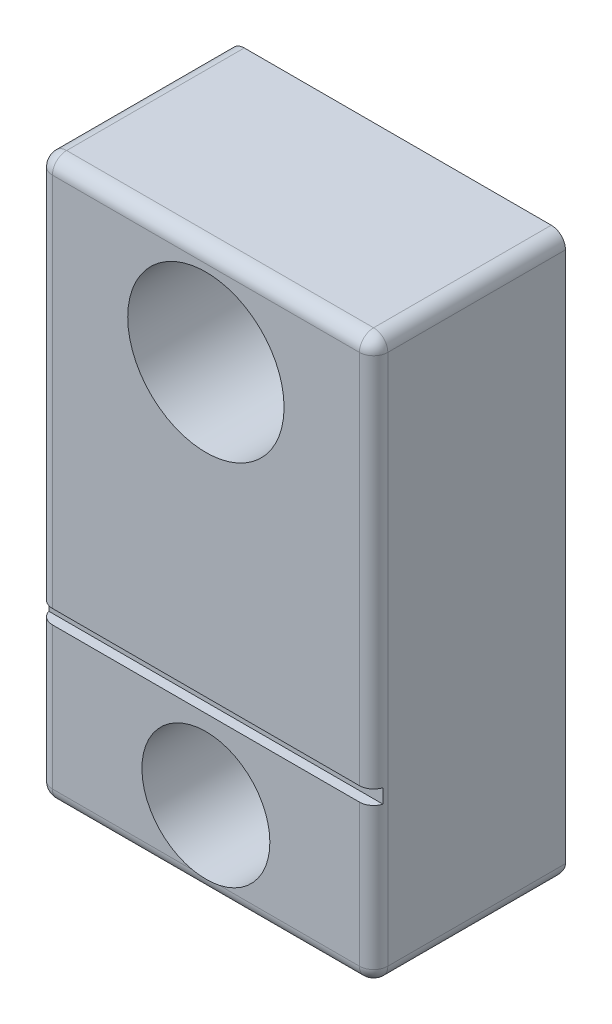
from build123d import *

# Parameters (mm, degrees)
SKETCH1_W           = 2.36
SKETCH1_H           = 3.94
BOSS_EXTRUDE1_DEPTH = 1.35
SKETCH2_W           = 0.07
SKETCH2_H           = 0.1
CUT_EXTRUDE1_DEPTH  = 4.357528853
FILLET2_R           = 0.1
SKETCH3_R           = 0.55
SKETCH3_R_2         = 0.45
CUT_EXTRUDE2_DEPTH  = 1


with BuildPart() as part:
    # Sketch1 → Boss-Extrude1 (new body)
    with BuildSketch(Plane.XY):
        Rectangle(SKETCH1_W, SKETCH1_H)
    extrude(amount=BOSS_EXTRUDE1_DEPTH)

    # Sketch2 → Cut-Extrude1 (cut, through all)
    with BuildSketch(Plane(origin=(1.18, 0, 0), x_dir=(0, 0, -1), z_dir=(1, 0, 0))):
        with Locations((-1.315, -0.82)):
            Rectangle(SKETCH2_W, SKETCH2_H)
    extrude(amount=-CUT_EXTRUDE1_DEPTH, mode=Mode.SUBTRACT)

    # Fillet2
    # the kernel refuses this fillet: 0.1 mm, written as the material it takes off along each edge
    with BuildSketch(Plane(origin=(-1.08, 1.87, 1.25), x_dir=(-1, 0, 0), z_dir=(0, 1, 0))) as fillet2_piece_1_section:
        Polygon((0, 0), (FILLET2_R, 0), (FILLET2_R, FILLET2_R), (0, FILLET2_R), align=None)
    fillet2_piece_1 = extrude(amount=FILLET2_R, mode=Mode.PRIVATE)
    fillet2_piece_1 = fillet2_piece_1 - Plane(origin=(-1.08, 1.87, 1.25), x_dir=(0.7071067811865475, 0, -0.7071067811865475), z_dir=(0, 1, 0)) * Sphere(FILLET2_R, mode=Mode.PRIVATE)
    add(fillet2_piece_1, mode=Mode.SUBTRACT)
    with BuildSketch(Plane(origin=(1.08, 1.87, 1.25), x_dir=(1, 0, 0), z_dir=(0, 1, 0))) as fillet2_piece_2_section:
        Polygon((0, 0), (FILLET2_R, 0), (FILLET2_R, -FILLET2_R), (0, -FILLET2_R), align=None)
    fillet2_piece_2 = extrude(amount=FILLET2_R, mode=Mode.PRIVATE)
    fillet2_piece_2 = fillet2_piece_2 - Plane(origin=(1.08, 1.87, 1.25), x_dir=(-0.7071067811865475, 0, -0.7071067811865475), z_dir=(0, 1, 0)) * Sphere(FILLET2_R, mode=Mode.PRIVATE)
    add(fillet2_piece_2, mode=Mode.SUBTRACT)
    with BuildSketch(Plane(origin=(-1.08, -1.87, 1.25), x_dir=(-1, 0, 0), z_dir=(0, 0, 1))) as fillet2_piece_3_section:
        Polygon((0, 0), (FILLET2_R, 0), (FILLET2_R, FILLET2_R), (0, FILLET2_R), align=None)
    fillet2_piece_3 = extrude(amount=FILLET2_R, mode=Mode.PRIVATE)
    fillet2_piece_3 = fillet2_piece_3 - Plane(origin=(-1.08, -1.87, 1.25), x_dir=(0.7071067811865475, 0.7071067811865477, 0), z_dir=(0, 0, 1)) * Sphere(FILLET2_R, mode=Mode.PRIVATE)
    add(fillet2_piece_3, mode=Mode.SUBTRACT)
    with BuildSketch(Plane(origin=(1.08, -1.87, 1.25), x_dir=(0, -1, 0), z_dir=(0, 0, 1))) as fillet2_piece_4_section:
        Polygon((0, 0), (FILLET2_R, 0), (FILLET2_R, FILLET2_R), (0, FILLET2_R), align=None)
    fillet2_piece_4 = extrude(amount=FILLET2_R, mode=Mode.PRIVATE)
    fillet2_piece_4 = fillet2_piece_4 - Plane(origin=(1.08, -1.87, 1.25), x_dir=(-0.7071067811865476, 0.7071067811865475, 0), z_dir=(0, 0, 1)) * Sphere(FILLET2_R, mode=Mode.PRIVATE)
    add(fillet2_piece_4, mode=Mode.SUBTRACT)
    with BuildSketch(Plane(origin=(-1.18, -1.02, 1.35), x_dir=(0, 0, -1), z_dir=(0, 1, 0)), Plane(origin=(1.18, 1.87, 1.35), x_dir=(0, 0, -1), z_dir=(0, -1, 0))) as fillet2_piece_5:
        with BuildLine():
            CenterArc((FILLET2_R, -FILLET2_R), FILLET2_R, 90, 90)
            Line((0, -FILLET2_R), (0, 0))
            Line((0, 0), (FILLET2_R, 0))
        make_face()
    extrude(amount=2.89, mode=Mode.SUBTRACT)
    with BuildSketch(Plane(origin=(-1.18, -1.87, 1.35), x_dir=(0, 0, -1), z_dir=(0, 1, 0)), Plane(origin=(1.18, -0.62, 1.35), x_dir=(0, 0, -1), z_dir=(0, -1, 0))) as fillet2_piece_6:
        with BuildLine():
            CenterArc((FILLET2_R, -FILLET2_R), FILLET2_R, 90, 90)
            Line((0, -FILLET2_R), (0, 0))
            Line((0, 0), (FILLET2_R, 0))
        make_face()
    extrude(amount=1.25, mode=Mode.SUBTRACT)
    with BuildSketch(Plane(origin=(1.08, -1.97, 1.35), x_dir=(0, 1, 0), z_dir=(-1, 0, 0))) as fillet2_piece_7:
        with BuildLine():
            CenterArc((FILLET2_R, FILLET2_R), FILLET2_R, 180, 90)
            Line((0, FILLET2_R), (0, 0))
            Line((0, 0), (FILLET2_R, 0))
        make_face()
    extrude(amount=2.16, mode=Mode.SUBTRACT)
    with BuildSketch(Plane(origin=(1.43, -1.97, 0), x_dir=(0, 1, 0), z_dir=(-1, 0, 0))) as fillet2_piece_8:
        with BuildLine():
            CenterArc((FILLET2_R, -FILLET2_R), FILLET2_R, 90, 90)
            Line((0, -FILLET2_R), (0, 0))
            Line((0, 0), (FILLET2_R, 0))
        make_face()
    extrude(amount=2.86, mode=Mode.SUBTRACT)
    with BuildSketch(Plane(origin=(1.18, -1.97, -0.25), x_dir=(0, 1, 0), z_dir=(0, 0, 1)), Plane(origin=(1.18, 1.97, -0.25), x_dir=(-1, 0, 0), z_dir=(0, 0, 1))) as fillet2_piece_9:
        with BuildLine():
            CenterArc((FILLET2_R, FILLET2_R), FILLET2_R, 180, 90)
            Line((0, FILLET2_R), (0, 0))
            Line((0, 0), (FILLET2_R, 0))
        make_face()
    extrude(amount=1.5, mode=Mode.SUBTRACT)
    with BuildSketch(Plane(origin=(-1.18, -1.97, -0.25), x_dir=(0, 1, 0), z_dir=(0, 0, 1)), Plane(origin=(-1.18, 1.97, -0.25), x_dir=(1, 0, 0), z_dir=(0, 0, 1))) as fillet2_piece_10:
        with BuildLine():
            CenterArc((FILLET2_R, -FILLET2_R), FILLET2_R, 90, 90)
            Line((0, -FILLET2_R), (0, 0))
            Line((0, 0), (FILLET2_R, 0))
        make_face()
    extrude(amount=1.5, mode=Mode.SUBTRACT)
    with BuildSketch(Plane(origin=(-1.08, 1.97, 1.35), x_dir=(0, 0, -1), z_dir=(1, 0, 0))) as fillet2_piece_11:
        with BuildLine():
            CenterArc((FILLET2_R, -FILLET2_R), FILLET2_R, 90, 90)
            Line((0, -FILLET2_R), (0, 0))
            Line((0, 0), (FILLET2_R, 0))
        make_face()
    extrude(amount=2.16, mode=Mode.SUBTRACT)

    # Sketch3 → Cut-Extrude2 (cut)
    with BuildSketch(Plane.XY.offset(1.35)):
        with Locations((0, 1.27)):
            Circle(SKETCH3_R)
        with Locations((0, -1.43)):
            Circle(SKETCH3_R_2)
    extrude(amount=-CUT_EXTRUDE2_DEPTH, mode=Mode.SUBTRACT)


solid = part.part
